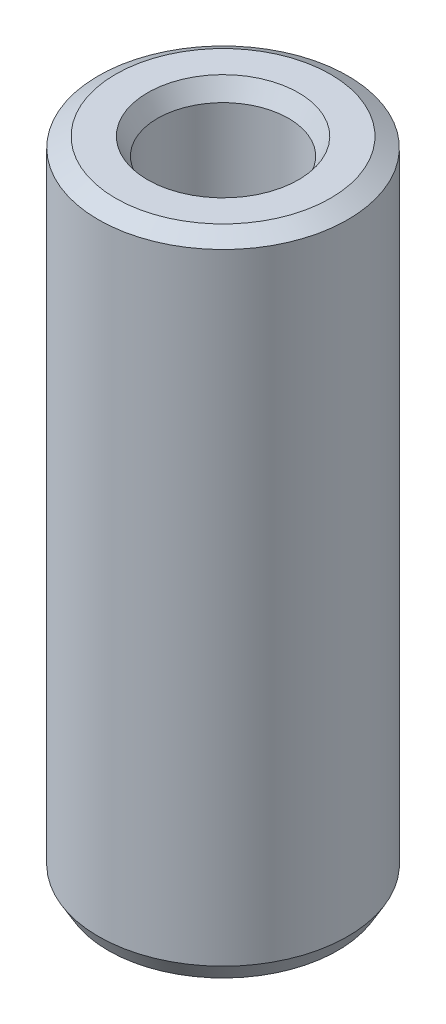
from build123d import *
from OCP.BRepFilletAPI import BRepFilletAPI_MakeChamfer

# Parameters (mm, degrees)
SKETCH1_R           = 27.5
BOSS_EXTRUDE1_DEPTH = 142.891635177
SKETCH2_R           = 14.453255575
CUT_EXTRUDE1_DEPTH  = 149.089565479
CHAMFER1_SIZE       = 2.194209195
CHAMFER1_SIZE2      = 3.800481809


with BuildPart() as part:
    # Sketch1 → Boss-Extrude1 (new body)
    with BuildSketch(Plane(origin=(0, 0, 0), x_dir=(1, 0, 0), z_dir=(0, 1, 0))):
        Circle(SKETCH1_R)
    extrude(amount=BOSS_EXTRUDE1_DEPTH)

    # Sketch2 → Cut-Extrude1 (cut, through all)
    with BuildSketch(Plane(origin=(0, 0, 0), x_dir=(1, 0, 0), z_dir=(0, 1, 0))):
        Circle(SKETCH2_R)
    extrude(amount=CUT_EXTRUDE1_DEPTH, mode=Mode.SUBTRACT)

    # Chamfer1: one chamfer whose edges measure the first distance from different faces: ONE call of the kernel's chamfer builder (chamfer() names one face for all edges)
    chamfer1_edges_1 = [part.edges().sort_by_distance(p)[0] for p in [
        (-14.453255575, 142.891635177, 0),
    ]]
    chamfer1_side_1 = [part.faces().sort_by_distance(p)[0] for p in [
        (-26.722182541, 142.891635177, 0),
    ]]
    chamfer1_edges_2 = [part.edges().sort_by_distance(p)[0] for p in [
        (-14.453255575, 0, 0),
    ]]
    chamfer1_side_2 = [part.faces().sort_by_distance(p)[0] for p in [
        (-14.453255575, 71.445817589, 0),
    ]]
    chamfer1_edges_3 = [part.edges().sort_by_distance(p)[0] for p in [
        (-27.5, 0, 0),
    ]]
    chamfer1_side_3 = [part.faces().sort_by_distance(p)[0] for p in [
        (-26.722182541, 0, 0),
    ]]
    chamfer1_edges_4 = [part.edges().sort_by_distance(p)[0] for p in [
        (-27.5, 142.891635177, 0),
    ]]
    chamfer1_side_4 = [part.faces().sort_by_distance(p)[0] for p in [
        (-27.5, 71.445817589, 0),
    ]]
    chamfer1 = BRepFilletAPI_MakeChamfer(part.part.solid().wrapped)
    for e in chamfer1_edges_1:
        chamfer1.Add(CHAMFER1_SIZE, CHAMFER1_SIZE2, e.wrapped, chamfer1_side_1[0].wrapped)  # the first distance lies on this face
    for e in chamfer1_edges_2:
        chamfer1.Add(CHAMFER1_SIZE, CHAMFER1_SIZE2, e.wrapped, chamfer1_side_2[0].wrapped)  # the first distance lies on this face
    for e in chamfer1_edges_3:
        chamfer1.Add(CHAMFER1_SIZE, CHAMFER1_SIZE2, e.wrapped, chamfer1_side_3[0].wrapped)  # the first distance lies on this face
    for e in chamfer1_edges_4:
        chamfer1.Add(CHAMFER1_SIZE, CHAMFER1_SIZE2, e.wrapped, chamfer1_side_4[0].wrapped)  # the first distance lies on this face
    add(Compound.cast(chamfer1.Shape()), mode=Mode.REPLACE)


solid = part.part
